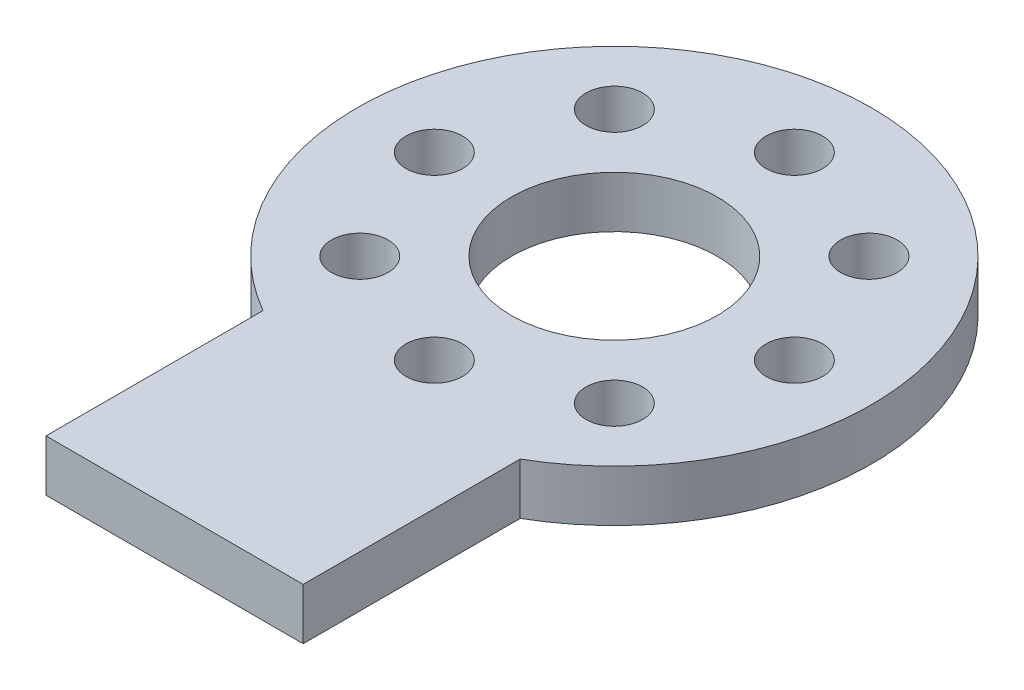
from build123d import *

# Parameters (mm, degrees)
BOSS_EXTRUDE1_DEPTH  = 5
M5_CLEARANCE_HOLE1_D = 5.5
SKETCH6_R            = 10
CUT_EXTRUDE1_DEPTH   = 50.773304207


with BuildPart() as part:
    # Sketch1 → Boss-Extrude1 (new body)
    with BuildSketch(Plane(origin=(0, 0, 0), x_dir=(1, 0, 0), z_dir=(0, 1, 0))):
        with BuildLine():
            Line((-12.5, -42.747886634), (12.5, -42.747886634))
            Line((12.5, -42.747886634), (12.5, -21.650635095))
            ThreePointArc((12.5, -21.650635095), (0, 25), (-12.5, -21.650635095))
            Line((-12.5, -21.650635095), (-12.5, -42.747886634))
        make_face()
    extrude(amount=BOSS_EXTRUDE1_DEPTH)

    # M5 Clearance Hole1 (through all)
    with Locations(Plane(origin=(0, 5, 0), x_dir=(1, 0, 0), z_dir=(0, 1, 0))):
        with Locations((-12.374368671, 12.374368671), (0, 17.5), (12.374368671, 12.374368671), (17.5, 0), (12.374368671, -12.374368671), (0, -17.5), (-12.374368671, -12.374368671), (-17.5, 0)):
            Hole(M5_CLEARANCE_HOLE1_D / 2)

    # Sketch6 → Cut-Extrude1 (cut, through all)
    with BuildSketch(Plane(origin=(0, 5, 0), x_dir=(1, 0, 0), z_dir=(0, 1, 0))):
        Circle(SKETCH6_R)
    extrude(amount=-CUT_EXTRUDE1_DEPTH, mode=Mode.SUBTRACT)


solid = part.part
